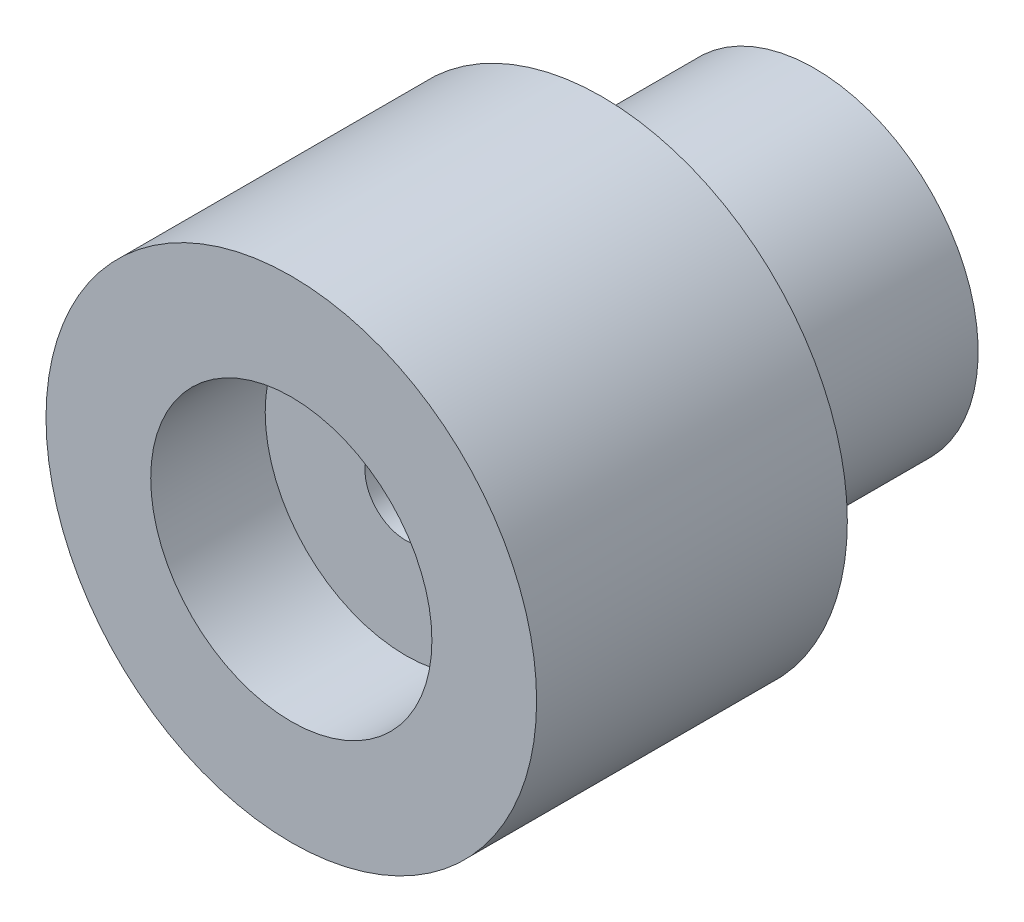
from build123d import *

# Parameters (mm, degrees)
SKETCH1_R           = 15
BOSS_EXTRUDE1_DEPTH = 19
SKETCH2_R           = 10
BOSS_EXTRUDE2_DEPTH = 13
SKETCH3_R           = 8.596778809
CUT_EXTRUDE1_DEPTH  = 7
SKETCH4_R           = 2.5
CUT_EXTRUDE2_DEPTH  = 100
SKETCH5_R           = 5.25
CUT_EXTRUDE3_DEPTH  = 13
SKETCH6_W           = 2.475194435
SKETCH6_H           = 4
CUT_EXTRUDE4_DEPTH  = 7


with BuildPart() as part:
    # Sketch1 → Boss-Extrude1 (new body)
    with BuildSketch(Plane.XY):
        Circle(SKETCH1_R)
    extrude(amount=BOSS_EXTRUDE1_DEPTH)

    # Sketch2 → Boss-Extrude2 (add)
    with BuildSketch(Plane(origin=(0, 0, 0), x_dir=(-1, 0, 0), z_dir=(0, 0, -1))):
        Circle(SKETCH2_R)
    extrude(amount=BOSS_EXTRUDE2_DEPTH)

    # Sketch3 → Cut-Extrude1 (cut)
    with BuildSketch(Plane.XY.offset(19)):
        Circle(SKETCH3_R)
    extrude(amount=-CUT_EXTRUDE1_DEPTH, mode=Mode.SUBTRACT)

    # Sketch4 → Cut-Extrude2 (cut)
    with BuildSketch(Plane.XY.offset(12)):
        Circle(SKETCH4_R)
    extrude(amount=-CUT_EXTRUDE2_DEPTH, mode=Mode.SUBTRACT)

    # Sketch5 → Cut-Extrude3 (cut)
    with BuildSketch(Plane(origin=(0, 0, -13), x_dir=(-1, 0, 0), z_dir=(0, 0, -1))):
        Circle(SKETCH5_R)
    extrude(amount=-CUT_EXTRUDE3_DEPTH, mode=Mode.SUBTRACT)

    # Sketch6 → Cut-Extrude4 (cut)
    with BuildSketch(Plane(origin=(0, 0, -13), x_dir=(-1, 0, 0), z_dir=(0, 0, -1))):
        with Locations((5.005803671, 0)):
            Rectangle(SKETCH6_W, SKETCH6_H)
    extrude(amount=-CUT_EXTRUDE4_DEPTH, mode=Mode.SUBTRACT)


solid = part.part
